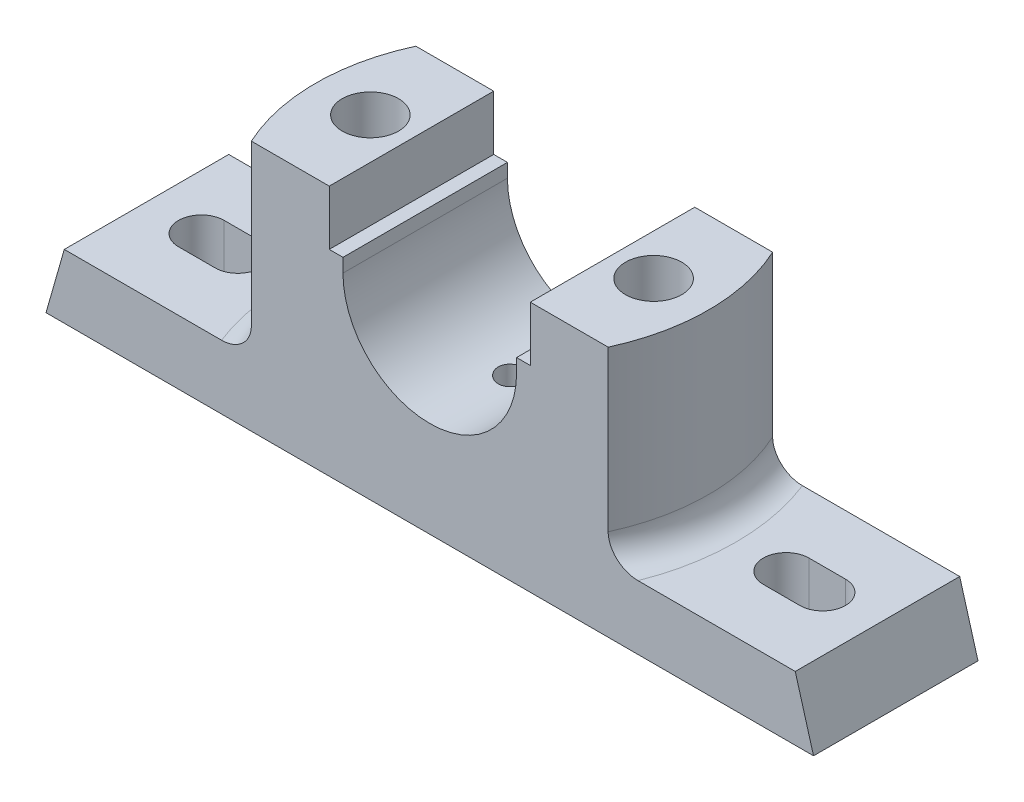
from build123d import *

# Parameters (mm, degrees)
BOSS_EXTRUDE1_DEPTH = 18
SKETCH2_W           = 68
SKETCH2_H           = 20
CUT_EXTRUDE2_DEPTH  = 2
SKETCH4_W           = 20
SKETCH4_H           = 20
CUT_EXTRUDE3_DEPTH  = 7
SKETCH5_R           = 6.163168956
CUT_EXTRUDE4_DEPTH  = 103.004901843
CUT_EXTRUDE5_START  = -41
CUT_EXTRUDE5_DEPTH  = 41
FILLET1_R           = 6


with BuildPart() as part:
    # Sketch1 → Boss-Extrude1 (new, symmetric)
    with BuildSketch(Plane.XY):
        with BuildLine():
            Line((-84, 0), (84, 0))
            Line((84, 0), (80, 14))
            Line((80, 14), (43, 14))
            Line((43, 14), (43, 55))
            Line((43, 55), (22, 55))
            Line((22, 55), (22, 43))
            Line((22, 43), (19, 43))
            Line((19, 43), (19, 40))
            ThreePointArc((19, 40), (0, 21), (-19, 40))
            Line((-19, 40), (-19, 43))
            Line((-19, 43), (-22, 43))
            Line((-22, 43), (-22, 55))
            Line((-22, 55), (-43, 55))
            Line((-43, 55), (-43, 14))
            Line((-43, 14), (-80, 14))
            Line((-80, 14), (-84, 0))
        make_face()
    extrude(amount=BOSS_EXTRUDE1_DEPTH, both=True)

    # Sketch2 → Cut-Extrude2 (cut)
    with BuildSketch(Plane.XZ):
        with Locations((-42, 0)):
            Rectangle(SKETCH2_W, SKETCH2_H)
        with Locations((42, 0)):
            Rectangle(SKETCH2_W, SKETCH2_H)
    extrude(amount=-CUT_EXTRUDE2_DEPTH, mode=Mode.SUBTRACT)

    # Sketch4 → Cut-Extrude3 (cut)
    with BuildSketch(Plane.XZ.offset(-2)):
        with Locations((-31, 0)):
            Rectangle(SKETCH4_W, SKETCH4_H)
        with Locations((31, 0)):
            Rectangle(SKETCH4_W, SKETCH4_H)
    extrude(amount=-CUT_EXTRUDE3_DEPTH, mode=Mode.SUBTRACT)

    # Sketch5 → Cut-Extrude4 (cut, through all)
    with BuildSketch(Plane.XZ):
        with Locations((-31, 0)):
            Circle(SKETCH5_R)
        with Locations(Location((31, 0, 0), (0, 0, 180))):
            Circle(SKETCH5_R)
        with BuildLine():
            Line((-68, 5), (-60, 5))
            ThreePointArc((-60, 5), (-55, 0), (-60, -5))
            Line((-60, -5), (-68, -5))
            ThreePointArc((-68, -5), (-73, 0), (-68, 5))
        make_face()
        with BuildLine():
            Line((68, 5), (60, 5))
            ThreePointArc((60, 5), (55, 0), (60, -5))
            Line((60, -5), (68, -5))
            ThreePointArc((68, -5), (73, 0), (68, 5))
        make_face()
    extrude(amount=-CUT_EXTRUDE4_DEPTH, mode=Mode.SUBTRACT)

    # Cut-Extrude5: read off the stored shape, not the designer's step
    # Cut-Extrude5 outline → Cut-Extrude5 (cut)
    with BuildSketch(Plane(origin=(0, 55, 0), x_dir=(1, 0, 0), z_dir=(0, 1, 0)).offset(CUT_EXTRUDE5_START)):
        with BuildLine():
            ThreePointArc((-43, 0), (-42.001212365, 9.214019744), (-39.05124838, 18))
            Line((-39.05124838, 18), (-43, 18))
            Line((-43, 18), (-43, 0))
        make_face()
        with BuildLine():
            ThreePointArc((-39.05124838, -18), (-42.001212365, -9.214019744), (-43, 0))
            Line((-43, 0), (-43, -18))
            Line((-43, -18), (-39.05124838, -18))
        make_face()
        with BuildLine():
            Line((43, 18), (39.05124838, 18))
            ThreePointArc((39.05124838, 18), (42.001212365, 9.214019744), (43, 0))
            Line((43, 0), (43, 18))
        make_face()
        with BuildLine():
            Line((43, -18), (43, 0))
            ThreePointArc((43, 0), (42.001212365, -9.214019744), (39.05124838, -18))
            Line((39.05124838, -18), (43, -18))
        make_face()
    extrude(amount=CUT_EXTRUDE5_DEPTH, mode=Mode.SUBTRACT)

    # Fillet1
    fillet1_edges = [part.edges().sort_by_distance(p)[0] for p in [
        (-42.001212365, 14, 9.214019744),
        (42.001212365, 14, -9.214019744),
    ]]
    fillet(fillet1_edges, radius=FILLET1_R)

    # Cut-Revolve1: read off the stored shape, not the designer's step
    # Cut-Revolve1 outline → Cut-Revolve1 (revolve, cut)
    with BuildSketch(Plane.XY):
        Polygon((0, 13.435755104), (3, 15.238336961), (3, 21.238467133), (0, 21.238467133), align=None)
    revolve(axis=Axis((0, 0, 0), (0, 1, 0)), mode=Mode.SUBTRACT)


solid = part.part
